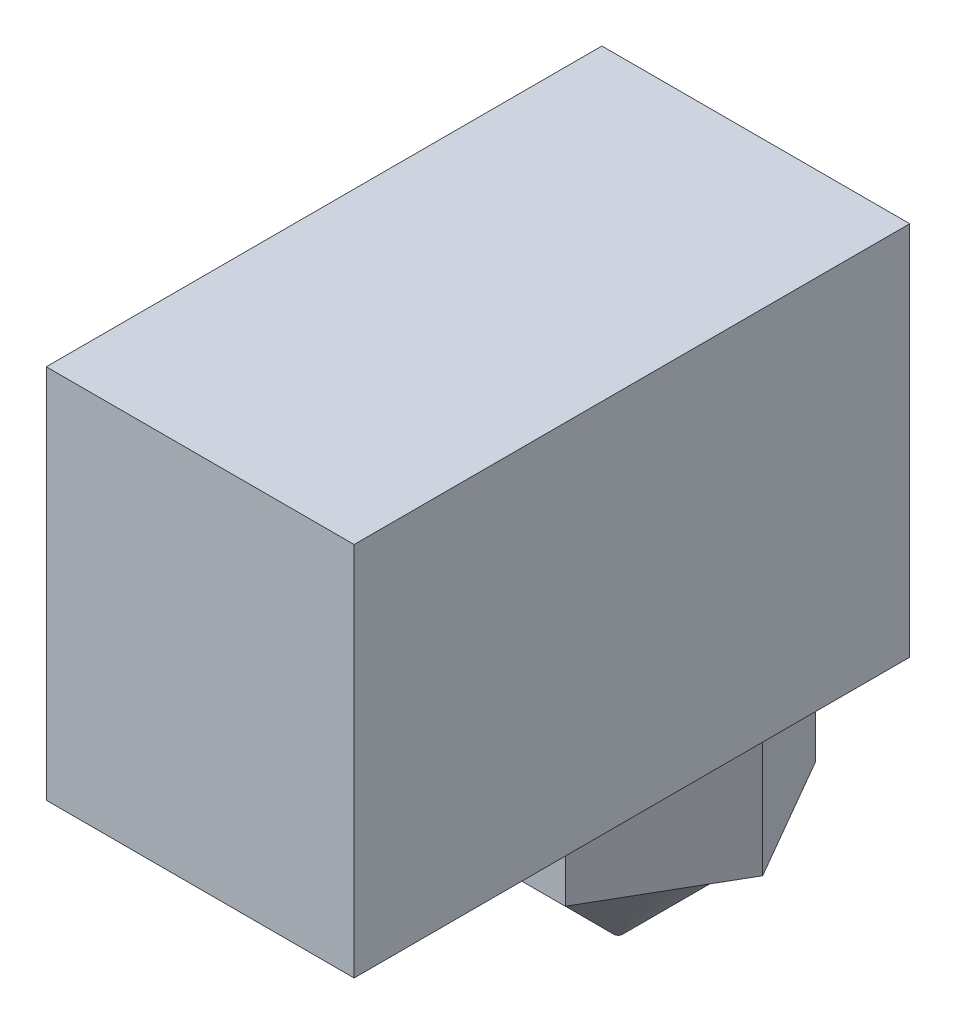
from build123d import *

# Parameters (mm, degrees)
BOSS_EXTRUDE1_DEPTH = 5
SKETCH4_R           = 0.175
CUT_EXTRUDE1_DEPTH  = 13.583057392
SKETCH5_W           = 12.3
SKETCH5_H           = 22.2
BOSS_EXTRUDE2_DEPTH = 15


with BuildPart() as part:
    # Sketch1 → Boss-Extrude1 (new body)
    with BuildSketch(Plane(origin=(0, 0, 0), x_dir=(1, 0, 0), z_dir=(0, 1, 0))):
        Polygon((5.773502692, 0), (2.886751346, 5), (-2.886751346, 5), (-5.773502692, 0), (-2.886751346, -5), (2.886751346, -5), align=None)
    extrude(amount=-BOSS_EXTRUDE1_DEPTH)

    # Sketch3 → Revolve1 (revolve)
    with BuildSketch(Plane.XY):
        Polygon((0, -5), (0, -10), (-5, -5), align=None)
    revolve(axis=Axis((0, -5, 0), (0, -1, 0)))

    # Sketch4 → Cut-Extrude1 (cut, through all)
    with BuildSketch(Plane(origin=(0, 0, 0), x_dir=(1, 0, 0), z_dir=(0, 1, 0))):
        Circle(SKETCH4_R)
    extrude(amount=-CUT_EXTRUDE1_DEPTH, mode=Mode.SUBTRACT)


with BuildPart() as body_2:
    # Sketch5 → Boss-Extrude2 (new body)
    with BuildSketch(Plane(origin=(0, 0, 0), x_dir=(1, 0, 0), z_dir=(0, 1, 0))):
        with Locations((0, -5.6)):
            Rectangle(SKETCH5_W, SKETCH5_H)
    extrude(amount=BOSS_EXTRUDE2_DEPTH)


solid = Compound([part.part, body_2.part])
